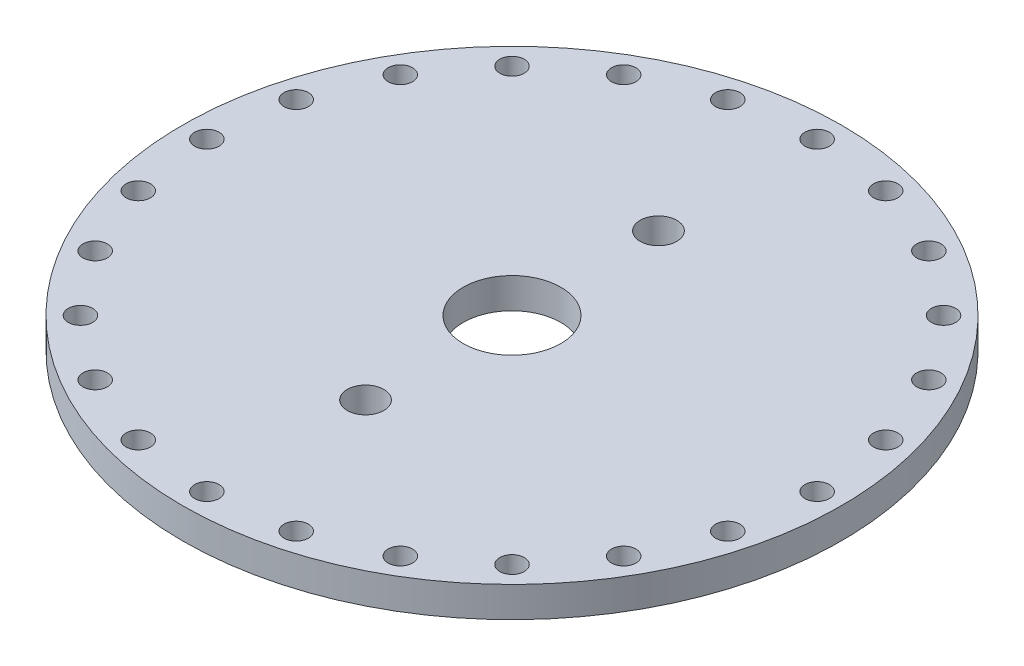
from build123d import *

# Parameters (mm, degrees)
SKETCH8_R           = 27
BOSS_EXTRUDE1_DEPTH = 2.5
CUT_EXTRUDE1_REACH  = 105.504
SKETCH6_R           = 4
SKETCH7_R           = 1.5
CUT_EXTRUDE2_DEPTH  = 2.5
SKETCH9_R           = 1
CUT_EXTRUDE3_DEPTH  = 2.5


with BuildPart() as part:
    # Sketch8 → Boss-Extrude1 (new body)
    with BuildSketch(Plane(origin=(0, 0, 0), x_dir=(1, 0, 0), z_dir=(0, 1, 0))):
        with Locations((45.924173915, 46.408574496)):
            Circle(SKETCH8_R)
    extrude(amount=BOSS_EXTRUDE1_DEPTH)

    # Sketch6 → Cut-Extrude1 (cut, up to next)
    with BuildSketch(Plane(origin=(0, 0, 0), x_dir=(1, 0, 0), z_dir=(0, 1, 0)), mode=Mode.PRIVATE) as cut_extrude1_sk1:
        with Locations((45.924173698, 46.408574279)):
            Circle(SKETCH6_R)
    cut_extrude1_tool1 = extrude(cut_extrude1_sk1.sketch, amount=CUT_EXTRUDE1_REACH, mode=Mode.PRIVATE) & part.part
    add(cut_extrude1_tool1.solids().sort_by_distance((45.924174, 0, -46.408574))[0], mode=Mode.SUBTRACT)

    # Sketch7 → Cut-Extrude2 (cut)
    with BuildSketch(Plane(origin=(0, 0, 0), x_dir=(1, 0, 0), z_dir=(0, 1, 0))):
        with Locations((45.924173698, 58.408574496)):
            Circle(SKETCH7_R)
        with Locations((45.924173698, 34.408574496)):
            Circle(SKETCH7_R)
    extrude(amount=CUT_EXTRUDE2_DEPTH, mode=Mode.SUBTRACT)

    # Sketch9 → Cut-Extrude3 (cut)
    with BuildSketch(Plane(origin=(0, 0, 0), x_dir=(1, 0, 0), z_dir=(0, 1, 0))):
        with Locations((45.924173698, 71.408574496)):
            Circle(SKETCH9_R)
        with Locations((52.394649826, 70.556720154)):
            Circle(SKETCH9_R)
        with Locations((58.424173698, 68.059209591)):
            Circle(SKETCH9_R)
        with Locations((63.601843228, 64.086244026)):
            Circle(SKETCH9_R)
        with Locations((67.574808793, 58.908574496)):
            Circle(SKETCH9_R)
        with Locations((70.072319355, 52.879050624)):
            Circle(SKETCH9_R)
        with Locations((70.924173698, 46.408574496)):
            Circle(SKETCH9_R)
        with Locations((70.072319355, 39.938098369)):
            Circle(SKETCH9_R)
        with Locations((67.574808793, 33.908574496)):
            Circle(SKETCH9_R)
        with Locations((63.601843228, 28.730904967)):
            Circle(SKETCH9_R)
        with Locations((58.424173698, 24.757939402)):
            Circle(SKETCH9_R)
        with Locations((52.394649826, 22.260428839)):
            Circle(SKETCH9_R)
        with Locations((45.924173698, 21.408574496)):
            Circle(SKETCH9_R)
        with Locations((39.45369757, 22.260428839)):
            Circle(SKETCH9_R)
        with Locations((33.424173698, 24.757939402)):
            Circle(SKETCH9_R)
        with Locations((28.246504168, 28.730904967)):
            Circle(SKETCH9_R)
        with Locations((24.273538603, 33.908574496)):
            Circle(SKETCH9_R)
        with Locations((21.776028041, 39.938098369)):
            Circle(SKETCH9_R)
        with Locations((20.924173698, 46.408574496)):
            Circle(SKETCH9_R)
        with Locations((21.776028041, 52.879050624)):
            Circle(SKETCH9_R)
        with Locations((24.273538603, 58.908574496)):
            Circle(SKETCH9_R)
        with Locations((28.246504168, 64.086244026)):
            Circle(SKETCH9_R)
        with Locations((33.424173698, 68.059209591)):
            Circle(SKETCH9_R)
        with Locations((39.45369757, 70.556720154)):
            Circle(SKETCH9_R)
    extrude(amount=CUT_EXTRUDE3_DEPTH, mode=Mode.SUBTRACT)


solid = part.part
